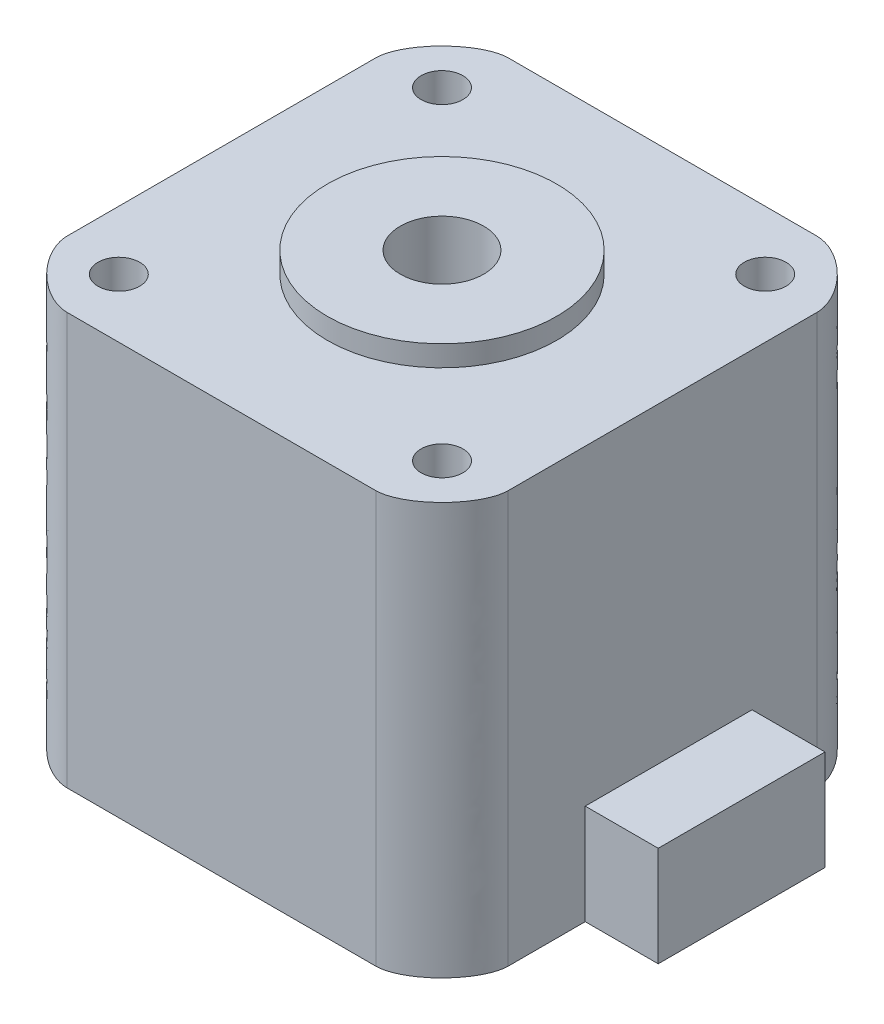
from build123d import *

# Parameters (mm, degrees)
SKETCH1_W                 = 42.3
SKETCH1_H                 = 42.3
BOSS_EXTRUDE1_DEPTH       = 39.5
SKETCH2_R                 = 11
BOSS_EXTRUDE2_DEPTH       = 2
FILLET1_SIZE              = 6.35
F_4_0MM_DOWEL_HOLE1_D     = 4
F_4_0MM_DOWEL_HOLE1_DEPTH = 4.572
F_4_0MM_DOWEL_HOLE1_TIP   = 1.201721238
SKETCH6_R                 = 4
CUT_EXTRUDE1_DEPTH        = 37
SKETCH7_W                 = 16
SKETCH7_H                 = 9.6
BOSS_EXTRUDE3_DEPTH       = 7


with BuildPart() as part:
    # Sketch1 → Boss-Extrude1 (new body)
    with BuildSketch(Plane(origin=(0, 0, 0), x_dir=(1, 0, 0), z_dir=(0, 1, 0))):
        with Locations((6.409090909, -3.738636364)):
            Rectangle(SKETCH1_W, SKETCH1_H)
    extrude(amount=BOSS_EXTRUDE1_DEPTH)

    # Sketch2 → Boss-Extrude2 (add)
    with BuildSketch(Plane(origin=(0, 39.5, 0), x_dir=(1, 0, 0), z_dir=(0, 1, 0))):
        with Locations(Location((6.409090909, -3.738636364, 0), (0, 0, 270))):
            Circle(SKETCH2_R)
    extrude(amount=BOSS_EXTRUDE2_DEPTH)

    # Fillet1
    # a fillet whose section is not a circle: 6.35 mm, written as the material it takes off along each edge
    with BuildSketch(Plane(origin=(-14.740909091, -15.875, -17.411363636), x_dir=(1, 0, 0), z_dir=(0, 1, 0)), Plane(origin=(-14.740909091, -15.875, 24.888636364), x_dir=(0, 0, -1), z_dir=(0, 1, 0))) as fillet1_piece_1:
        with BuildLine():
            Bezier((FILLET1_SIZE, 0), (0, 0), (0, -FILLET1_SIZE), weights=[1, 0.449012806, 1])
            Line((0, -FILLET1_SIZE), (0, 0))
            Line((0, 0), (FILLET1_SIZE, 0))
        make_face()
    extrude(amount=71.25, mode=Mode.SUBTRACT)
    with BuildSketch(Plane(origin=(27.559090909, -15.875, -17.411363636), x_dir=(-1, 0, 0), z_dir=(0, 1, 0)), Plane(origin=(27.559090909, -15.875, 24.888636364), x_dir=(0, 0, -1), z_dir=(0, 1, 0))) as fillet1_piece_2:
        with BuildLine():
            Bezier((FILLET1_SIZE, 0), (0, 0), (0, FILLET1_SIZE), weights=[1, 0.449012806, 1])
            Line((0, FILLET1_SIZE), (0, 0))
            Line((0, 0), (FILLET1_SIZE, 0))
        make_face()
    extrude(amount=71.25, mode=Mode.SUBTRACT)

    # Ø4.0mm Dowel Hole1
    with Locations(Plane(origin=(0, 39.5, 0), x_dir=(1, 0, 0), z_dir=(0, 1, 0))):
        with Locations((-9.092111006, 11.76136359), (21.907888994, 11.76136359), (21.910292824, -19.238636317), (-9.089707176, -19.23863641)):
            Hole(F_4_0MM_DOWEL_HOLE1_D / 2, depth=F_4_0MM_DOWEL_HOLE1_DEPTH)
            with Locations((0, 0, -(F_4_0MM_DOWEL_HOLE1_DEPTH + F_4_0MM_DOWEL_HOLE1_TIP / 2))):  # 118° drill point
                Cone(0, F_4_0MM_DOWEL_HOLE1_D / 2, F_4_0MM_DOWEL_HOLE1_TIP, mode=Mode.SUBTRACT)

    # Sketch6 → Cut-Extrude1 (cut)
    with BuildSketch(Plane(origin=(0, 41.5, 0), x_dir=(1, 0, 0), z_dir=(0, 1, 0))):
        with Locations(Location((6.409090909, -3.738636364, 0), (0, 0, 270))):
            Circle(SKETCH6_R)
    extrude(amount=-CUT_EXTRUDE1_DEPTH, mode=Mode.SUBTRACT)

    # Sketch7 → Boss-Extrude3 (add)
    with BuildSketch(Plane(origin=(27.559090909, 0, 0), x_dir=(0, 0, -1), z_dir=(1, 0, 0))):
        with Locations((-3.15108899, 4.8)):
            Rectangle(SKETCH7_W, SKETCH7_H)
    extrude(amount=BOSS_EXTRUDE3_DEPTH)


solid = part.part
